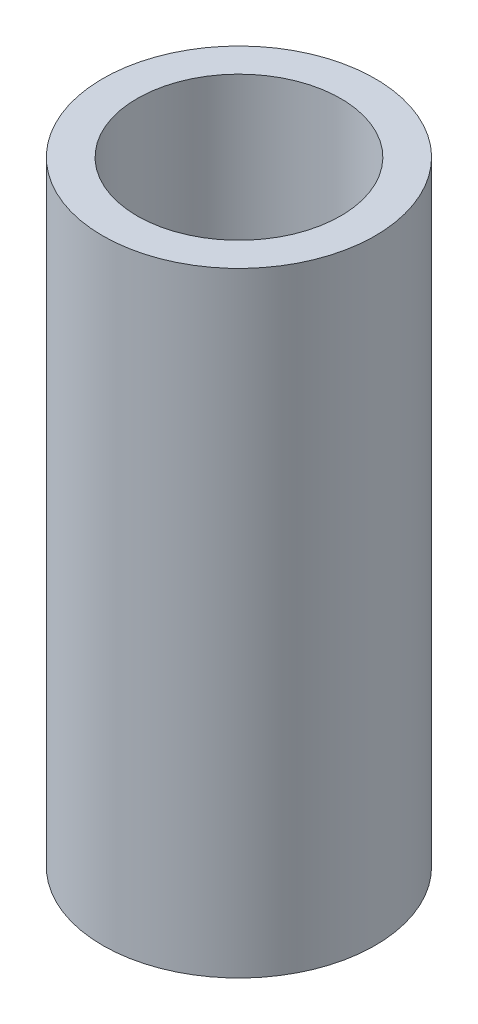
from build123d import *

# Parameters (mm, degrees)
SKETCH1_R           = 15
BOSS_EXTRUDE1_DEPTH = 67.674512614
SKETCH2_R           = 11.206541778
CUT_EXTRUDE1_DEPTH  = 71.92136249


with BuildPart() as part:
    # Sketch1 → Boss-Extrude1 (new body)
    with BuildSketch(Plane(origin=(0, 0, 0), x_dir=(1, 0, 0), z_dir=(0, 1, 0))):
        Circle(SKETCH1_R)
    extrude(amount=BOSS_EXTRUDE1_DEPTH)

    # Sketch2 → Cut-Extrude1 (cut, through all)
    with BuildSketch(Plane(origin=(0, 0, 0), x_dir=(1, 0, 0), z_dir=(0, 1, 0))):
        Circle(SKETCH2_R)
    extrude(amount=CUT_EXTRUDE1_DEPTH, mode=Mode.SUBTRACT)


solid = part.part
